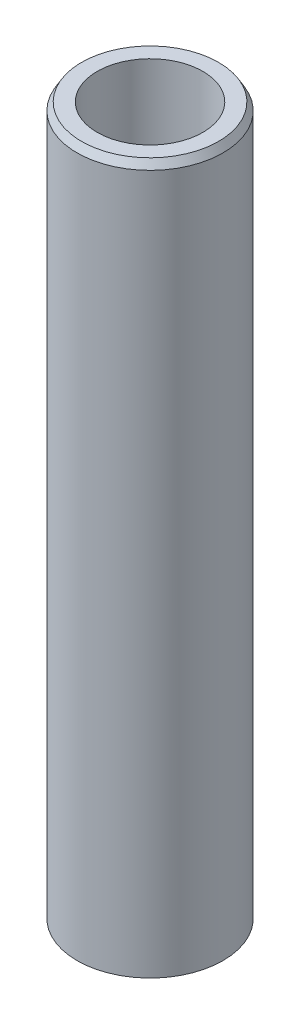
from build123d import *
from OCP.BRepFilletAPI import BRepFilletAPI_MakeChamfer

# Parameters (mm, degrees)
SKETCH1_R           = 15
BOSS_EXTRUDE1_DEPTH = 146.294640495
SKETCH2_R           = 10.86766989
CUT_EXTRUDE1_DEPTH  = 148.82463204
CHAMFER1_SIZE       = 1.587293058
CHAMFER1_SIZE2      = 0.916424074


with BuildPart() as part:
    # Sketch1 → Boss-Extrude1 (new body)
    with BuildSketch(Plane(origin=(0, 0, 0), x_dir=(1, 0, 0), z_dir=(0, 1, 0))):
        Circle(SKETCH1_R)
    extrude(amount=BOSS_EXTRUDE1_DEPTH)

    # Sketch2 → Cut-Extrude1 (cut, through all)
    with BuildSketch(Plane(origin=(0, 0, 0), x_dir=(1, 0, 0), z_dir=(0, 1, 0))):
        Circle(SKETCH2_R)
    extrude(amount=CUT_EXTRUDE1_DEPTH, mode=Mode.SUBTRACT)

    # Chamfer1: one chamfer whose edges measure the first distance from different faces: ONE call of the kernel's chamfer builder (chamfer() names one face for all edges)
    chamfer1_edges_1 = [part.edges().sort_by_distance(p)[0] for p in [
        (-15, 146.294640495, 0),
    ]]
    chamfer1_side_1 = [part.faces().sort_by_distance(p)[0] for p in [
        (-15, 73.147320248, 0),
    ]]
    chamfer1_edges_2 = [part.edges().sort_by_distance(p)[0] for p in [
        (-15, 0, 0),
    ]]
    chamfer1_side_2 = [part.faces().sort_by_distance(p)[0] for p in [
        (-14.575735931, 0, 0),
    ]]
    chamfer1 = BRepFilletAPI_MakeChamfer(part.part.solid().wrapped)
    for e in chamfer1_edges_1:
        chamfer1.Add(CHAMFER1_SIZE, CHAMFER1_SIZE2, e.wrapped, chamfer1_side_1[0].wrapped)  # the first distance lies on this face
    for e in chamfer1_edges_2:
        chamfer1.Add(CHAMFER1_SIZE, CHAMFER1_SIZE2, e.wrapped, chamfer1_side_2[0].wrapped)  # the first distance lies on this face
    add(Compound.cast(chamfer1.Shape()), mode=Mode.REPLACE)


solid = part.part
